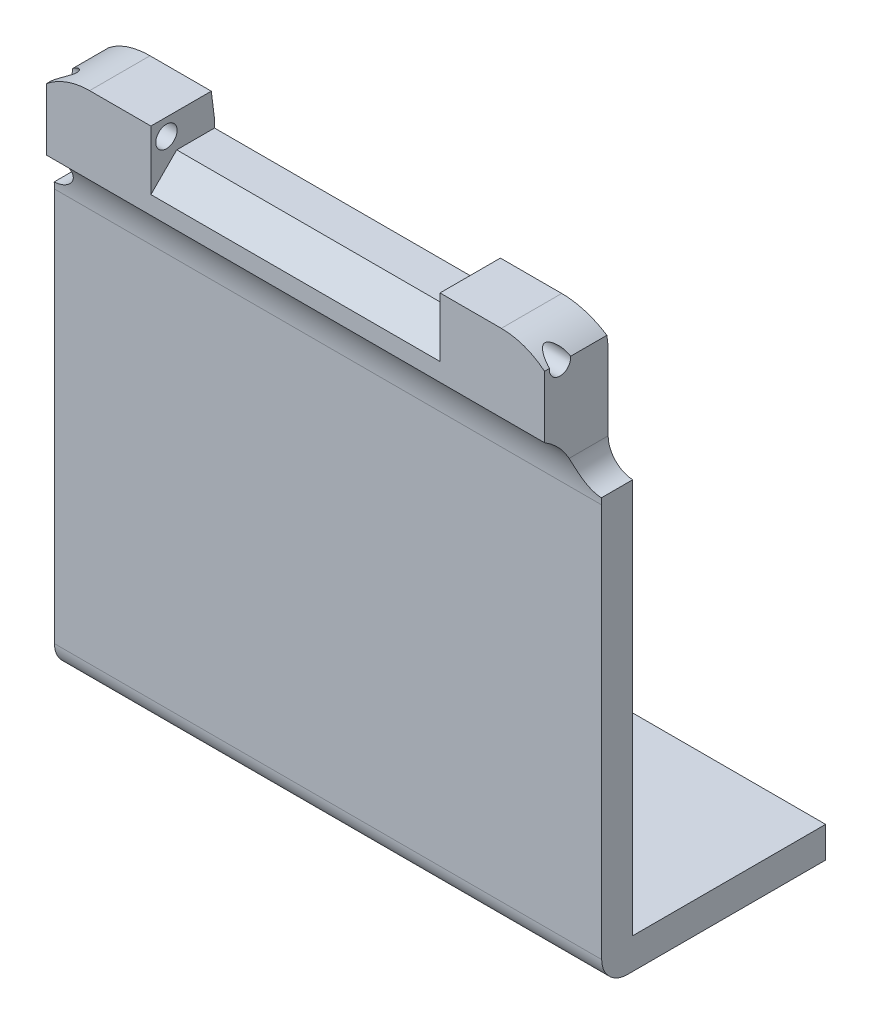
from build123d import *

# Parameters (mm, degrees)
SKETCH1_W           = 42.4
SKETCH1_H           = 40.6
BOSS_EXTRUDE1_DEPTH = 2.4
SKETCH2_W           = 40
SKETCH2_H           = 2.4
BOSS_EXTRUDE2_DEPTH = 17.35
SKETCH3_W           = 22.4
SKETCH3_H           = 2.6
CUT_EXTRUDE1_DEPTH  = 2.4
BOSS_EXTRUDE3_DEPTH = 2.53
FILLET1_R           = 5.25
FILLET2_R           = 5.25
CUT_EXTRUDE2_DEPTH  = 16.4
FILLET3_R           = 2
CHAMFER1_SIZE       = 2
SKETCH9_W           = 1.9
SKETCH9_H           = 10
CUT_EXTRUDE4_DEPTH  = 61.577409156
FILLET5_R           = 2
BOSS_EXTRUDE4_DEPTH = 2.4
CUT_EXTRUDE5_START  = -8.1
SKETCH4_R           = 0.8255
CUT_EXTRUDE5_DEPTH  = 38.6


with BuildPart() as part:
    # Sketch1 → Boss-Extrude1 (new body)
    with BuildSketch(Plane.XY):
        with Locations((21.2, 20.3)):
            Rectangle(SKETCH1_W, SKETCH1_H)
    extrude(amount=BOSS_EXTRUDE1_DEPTH)

    # Sketch2 → Boss-Extrude2 (add)
    with BuildSketch(Plane.XY.offset(2.4)):
        with Locations((20, -1.2)):
            Rectangle(SKETCH2_W, SKETCH2_H)
    extrude(amount=-BOSS_EXTRUDE2_DEPTH)

    # Sketch3 → Cut-Extrude1 (cut)
    with BuildSketch(Plane.XY.offset(2.4)):
        with Locations((21.2, 39.3)):
            Rectangle(SKETCH3_W, SKETCH3_H)
    extrude(amount=-CUT_EXTRUDE1_DEPTH, mode=Mode.SUBTRACT)

    # Sketch5 → Boss-Extrude3 (add)
    with BuildSketch(Plane.XY.offset(2.4)):
        Polygon((0, 40.6), (0, 34.6), (42.4, 34.6), (42.4, 40.6), (32.4, 40.6), (32.4, 38), (10, 38), (10, 40.6), align=None)
    extrude(amount=BOSS_EXTRUDE3_DEPTH)

    # Fillet1
    fillet1_edges = [part.edges().sort_by_distance(p)[0] for p in [
        (0, 40.6, 2.465),
        (42.4, 40.6, 2.465),
    ]]
    fillet(fillet1_edges, radius=FILLET1_R)

    # Fillet2
    # the kernel refuses this fillet: 5.25 mm, written as the material it adds along each edge
    with BuildSketch(Plane(origin=(0, 34.6, 2.4), x_dir=(0, 0, 1), z_dir=(1, 0, 0))) as fillet2_piece_1:
        with BuildLine():
            CenterArc((5.25, 4.490445412), FILLET2_R, 180, 58.795429652)
            Line((0, 4.490445412), (-0.105, 4.490445412))
            Line((-0.105, 4.490445412), (-0.105, 0))
            Line((-0.105, 0), (0, -0.105))
            ThreePointArc((0, -0.105), (1.265, -0.105), (2.4756, -0.089808908))
            Line((2.4756, -0.089808908), (2.53, 0))
        make_face()
    extrude(amount=42.4)

    # Sketch6 → Cut-Extrude2 (cut)
    with BuildSketch(Plane.ZY.offset(-32.4)):
        Polygon((0, 40.6), (0, 38.6), (0.25, 40.6), align=None)
    cut_extrude2 = extrude(amount=-CUT_EXTRUDE2_DEPTH, mode=Mode.SUBTRACT)

    # Fillet3
    fillet3_edges = [part.edges().sort_by_distance(p)[0] for p in [
        (20, -2.4, 2.4),
    ]]
    fillet(fillet3_edges, radius=FILLET3_R)

    # Chamfer1
    chamfer1_edges = [part.edges().sort_by_distance(p)[0] for p in [
        (21.2, 38, 4.93),
    ]]
    chamfer(chamfer1_edges, length=CHAMFER1_SIZE)

    # Sketch9 → Cut-Extrude4 (cut, through all)
    with BuildSketch(Plane(origin=(0, 0, 0), x_dir=(-1, 0, 0), z_dir=(0, 0, -1))):
        with Locations((-41.45, 35.6)):
            Rectangle(SKETCH9_W, SKETCH9_H)
        with Locations((-0.95, 35.6)):
            Rectangle(SKETCH9_W, SKETCH9_H)
    extrude(amount=-CUT_EXTRUDE4_DEPTH, mode=Mode.SUBTRACT)

    # Fillet5
    # the kernel refuses this fillet: 2 mm, written as the material it adds along each edge
    with BuildSketch(Plane(origin=(1.9, 30.6, 0), x_dir=(0, 1, 0), z_dir=(0, 0, 1))) as fillet5_piece_1_section:
        with BuildLine():
            CenterArc((1.997498436, 2), FILLET5_R, 182.865983983, 87.134016017)
            Line((0, 1.9), (-0.039949969, 1.898))
            ThreePointArc((-0.039949969, 1.898), (-0.04, 0.95), (-0.04, 0))
            Line((-0.04, 0), (0, -0.04))
            Line((0, -0.04), (1.997498436, -0.04))
            Line((1.997498436, -0.04), (1.997498436, 0))
        make_face()
    fillet5_piece_1 = extrude(amount=7.416704545, mode=Mode.PRIVATE)
    fillet5_piece_1 = fillet5_piece_1 - Plane(origin=(1.464355644, 30.109554588, 7.65), x_dir=(0, 0, 1), z_dir=(-1, 0, 0)) * Cylinder(5.25, 23, mode=Mode.PRIVATE)
    add(fillet5_piece_1)
    with BuildSketch(Plane(origin=(40.5, 30.6, 0), x_dir=(0, 1, 0), z_dir=(0, 0, 1))) as fillet5_piece_2_section:
        with BuildLine():
            CenterArc((1.997498436, -2), FILLET5_R, 90, 87.134016017)
            Line((0, -1.9), (-0.039949969, -1.898))
            ThreePointArc((-0.039949969, -1.898), (-0.04, -0.95), (-0.04, 0))
            Line((-0.04, 0), (0, 0.04))
            Line((0, 0.04), (1.997498436, 0.04))
            Line((1.997498436, 0.04), (1.997498436, 0))
        make_face()
    fillet5_piece_2 = extrude(amount=7.416704545, mode=Mode.PRIVATE)
    fillet5_piece_2 = fillet5_piece_2 - Plane(origin=(40.935644356, 30.109554588, 7.65), x_dir=(0, 0, 1), z_dir=(-1, 0, 0)) * Cylinder(5.25, 23, mode=Mode.PRIVATE)
    add(fillet5_piece_2)

    # Sketch10 → Boss-Extrude4 (add)
    with BuildSketch(Plane(origin=(40, 0, 0), x_dir=(0, 0, -1), z_dir=(1, 0, 0))):
        with BuildLine():
            Line((-2.4, 0), (-2.4, -0.4))
            ThreePointArc((-2.4, -0.4), (-1.814213562, -1.814213562), (-0.4, -2.4))
            Line((-0.4, -2.4), (14.95, -2.4))
            Line((14.95, -2.4), (14.95, 0))
            Line((14.95, 0), (0, 0))
            Line((0, 0), (-2.4, 0))
        make_face()
    extrude(amount=BOSS_EXTRUDE4_DEPTH)

    # Mirror1: Cut-Extrude2 across plane
    add(cut_extrude2.mirror(Plane(origin=(21.2, 0, 0), x_dir=(0, 0, 1), z_dir=(1, 0, 0))), mode=Mode.SUBTRACT)

    # Sketch4 → Cut-Extrude5 (cut)
    with BuildSketch(Plane(origin=(10, 0, 0), x_dir=(0, 0, -1), z_dir=(1, 0, 0)).offset(CUT_EXTRUDE5_START)):
        with Locations(Location((-3.73, 39.3, 0), (0, 0, 173.581911643))):
            Circle(SKETCH4_R)
    extrude(amount=CUT_EXTRUDE5_DEPTH, mode=Mode.SUBTRACT)


solid = part.part
